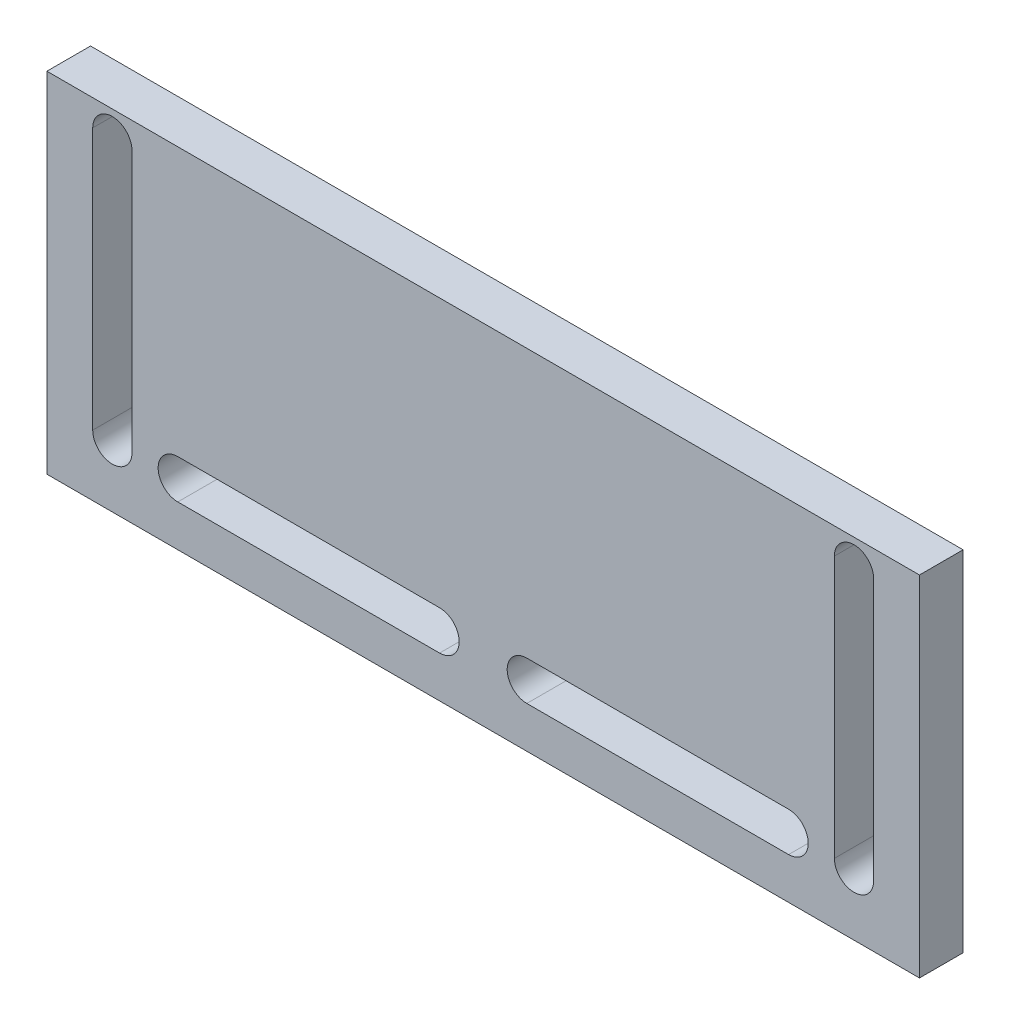
from build123d import *

# Parameters (mm, degrees)
SKETCH1_W           = 100
SKETCH1_H           = 40
BOSS_EXTRUDE1_DEPTH = 5
CUT_EXTRUDE1_DEPTH  = 5
CUT_EXTRUDE2_DEPTH  = 5
CUT_EXTRUDE3_DEPTH  = 5
CUT_EXTRUDE4_DEPTH  = 5


with BuildPart() as part:
    # Sketch1 → Boss-Extrude1 (new body)
    with BuildSketch(Plane.XY):
        Rectangle(SKETCH1_W, SKETCH1_H)
    extrude(amount=BOSS_EXTRUDE1_DEPTH)

    # Sketch2 → Cut-Extrude1 (cut)
    with BuildSketch(Plane.XY.offset(5)):
        with BuildLine():
            Line((-40.25, 17), (-40.25, -13))
            ThreePointArc((-40.25, -13), (-42.5, -15.25), (-44.75, -13))
            Line((-44.75, -13), (-44.75, 17))
            ThreePointArc((-44.75, 17), (-42.5, 19.25), (-40.25, 17))
        make_face()
    extrude(amount=-CUT_EXTRUDE1_DEPTH, mode=Mode.SUBTRACT)

    # Sketch2<3> → Cut-Extrude2 (cut)
    with BuildSketch(Plane.XY.offset(5)):
        with BuildLine():
            Line((-35, -10.75), (-5, -10.75))
            ThreePointArc((-5, -10.75), (-2.75, -13), (-5, -15.25))
            Line((-5, -15.25), (-35, -15.25))
            ThreePointArc((-35, -15.25), (-37.25, -13), (-35, -10.75))
        make_face()
    extrude(amount=-CUT_EXTRUDE2_DEPTH, mode=Mode.SUBTRACT)

    # Sketch2<4> → Cut-Extrude3 (cut)
    with BuildSketch(Plane.XY.offset(5)):
        with BuildLine():
            Line((5, -10.75), (35, -10.75))
            ThreePointArc((35, -10.75), (37.25, -13), (35, -15.25))
            Line((35, -15.25), (5, -15.25))
            ThreePointArc((5, -15.25), (2.75, -13), (5, -10.75))
        make_face()
    extrude(amount=-CUT_EXTRUDE3_DEPTH, mode=Mode.SUBTRACT)

    # Sketch2<5> → Cut-Extrude4 (cut)
    with BuildSketch(Plane.XY.offset(5)):
        with BuildLine():
            Line((44.75, 17), (44.75, -13))
            ThreePointArc((44.75, -13), (42.5, -15.25), (40.25, -13))
            Line((40.25, -13), (40.25, 17))
            ThreePointArc((40.25, 17), (42.5, 19.25), (44.75, 17))
        make_face()
    extrude(amount=-CUT_EXTRUDE4_DEPTH, mode=Mode.SUBTRACT)


solid = part.part
